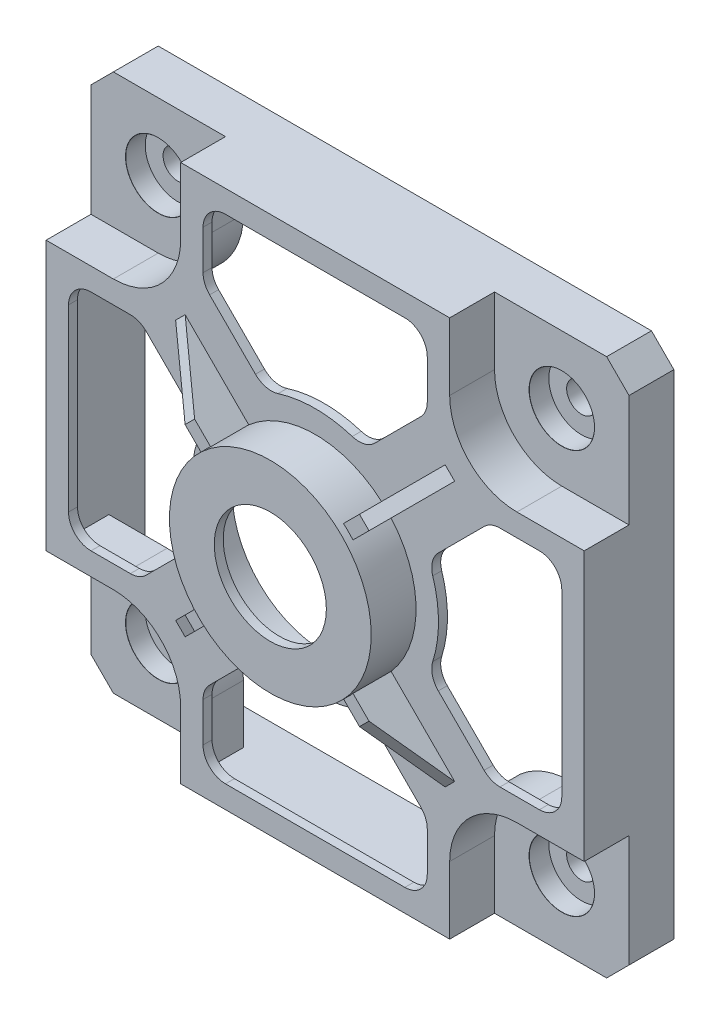
from build123d import *

# Parameters (mm, degrees)
SKETCH1_W                              = 120
SKETCH1_H                              = 120
BOSS_EXTRUDE1_DEPTH                    = 20
SKETCH2_R                              = 22.5
BOSS_EXTRUDE2_DEPTH                    = 10
CUT_EXTRUDE1_DEPTH                     = 10
MIRROR2_COPY_1_DEPTH                   = 10
CHAMFER1_SIZE                          = 5
SHELL1_DEPTH                           = 18
SHELL1_2_DEPTH                         = 8
SHELL1_START                           = 18
SHELL1_3_OUTLINE_R                     = 20.5
SHELL1_3_DEPTH                         = 10
SHELL1_START_2                         = 28
SHELL1_4_OUTLINE_R                     = 12.5
SHELL1_4_DEPTH                         = 2
BOSS_EXTRUDE3_REACH                    = 92
SKETCH6_R                              = 8.75
CIRPATTERN1_COUNT                      = 4
CBORE_FOR_M6_HEX_HEAD_BOLT1_AT_2_COUNT = 2
CBORE_FOR_M6_HEX_HEAD_BOLT1_AT_2_PITCH = 90
CBORE_FOR_M6_HEX_HEAD_BOLT1_AT_3_COUNT = 2
CBORE_FOR_M6_HEX_HEAD_BOLT1_AT_3_PITCH = 127.279220614
CBORE_FOR_M6_HEX_HEAD_BOLT1_AT_4_COUNT = 2
CBORE_FOR_M6_HEX_HEAD_BOLT1_AT_4_PITCH = 90
CUT_EXTRUDE2_REACH                     = 89.178
CIRPATTERN2_COUNT                      = 4
RIB1_START                             = -1.5
RIB1_DEPTH                             = 3
CIRPATTERN3_COUNT                      = 4


# Read off the part's stored shape, not the designer's step: Shell1, Rib1
with BuildPart() as part:
    # Sketch1 → Boss-Extrude1 (new body)
    with BuildSketch(Plane.XY):
        Rectangle(SKETCH1_W, SKETCH1_H)
    extrude(amount=BOSS_EXTRUDE1_DEPTH)

    # Sketch2 → Boss-Extrude2 (add)
    with BuildSketch(Plane.XY.offset(20)):
        Circle(SKETCH2_R)
    extrude(amount=BOSS_EXTRUDE2_DEPTH)

    # Sketch4 → Cut-Extrude1 (cut)
    with BuildSketch(Plane.XY.offset(20)):
        with BuildLine():
            Line((60, 60), (30, 60))
            Line((30, 60), (30, 45))
            ThreePointArc((30, 45), (34.393398282, 34.393398282), (45, 30))
            Line((45, 30), (60, 30))
            Line((60, 30), (60, 60))
        make_face()
    cut_extrude1 = extrude(amount=-CUT_EXTRUDE1_DEPTH, mode=Mode.SUBTRACT)

    # Mirror1: Cut-Extrude1 across plane
    add(cut_extrude1.mirror(Plane(origin=(0, 0, 0), x_dir=(0, 0, 1), z_dir=(1, 0, 0))), mode=Mode.SUBTRACT)

    # Mirror2: Cut-Extrude1 across plane
    add(cut_extrude1.mirror(Plane.ZX), mode=Mode.SUBTRACT)

    # Mirror2 copy 1 sketch → Mirror2 copy 1 (cut)
    with BuildSketch(Plane(origin=(0, 0, 20), x_dir=(-1, 0, 0), z_dir=(0, 0, 1))):
        with BuildLine():
            Line((60, 60), (30, 60))
            Line((30, 60), (30, 45))
            ThreePointArc((30, 45), (34.393398282, 34.393398282), (45, 30))
            Line((45, 30), (60, 30))
            Line((60, 30), (60, 60))
        make_face()
    extrude(amount=-MIRROR2_COPY_1_DEPTH, mode=Mode.SUBTRACT)

    # Chamfer1
    chamfer1_edges = [part.edges().sort_by_distance(p)[0] for p in [
        (60, 60, 5),
        (-60, 60, 5),
        (-60, -60, 5),
        (60, -60, 5),
    ]]
    chamfer(chamfer1_edges, length=CHAMFER1_SIZE)

    # Shell1 outline → Shell1 (cut)
    with BuildSketch(Plane.XY):
        with BuildLine():
            Line((58, -28), (58, 28))
            Line((58, 28), (45, 28))
            ThreePointArc((45, 28), (32.97918472, 32.97918472), (28, 45))
            Line((28, 45), (28, 58))
            Line((28, 58), (-28, 58))
            Line((-28, 58), (-28, 45))
            ThreePointArc((-28, 45), (-32.97918472, 32.97918472), (-45, 28))
            Line((-45, 28), (-58, 28))
            Line((-58, 28), (-58, -28))
            Line((-58, -28), (-45, -28))
            ThreePointArc((-45, -28), (-32.97918472, -32.97918472), (-28, -45))
            Line((-28, -45), (-28, -58))
            Line((-28, -58), (28, -58))
            Line((28, -58), (28, -45))
            ThreePointArc((28, -45), (32.97918472, -32.97918472), (45, -28))
            Line((45, -28), (58, -28))
        make_face()
    extrude(amount=SHELL1_DEPTH, mode=Mode.SUBTRACT)

    # Shell1 2 outline → Shell1 2 (cut)
    with BuildSketch(Plane.XY):
        with BuildLine():
            Line((58, 28), (58, 54.171572875))
            Line((58, 54.171572875), (54.171572875, 58))
            Line((54.171572875, 58), (28, 58))
            Line((28, 58), (28, 45))
            ThreePointArc((28, 45), (32.97918472, 32.97918472), (45, 28))
            Line((45, 28), (58, 28))
        make_face()
        with BuildLine():
            Line((58, -54.171572875), (58, -28))
            Line((58, -28), (45, -28))
            ThreePointArc((45, -28), (32.97918472, -32.97918472), (28, -45))
            Line((28, -45), (28, -58))
            Line((28, -58), (54.171572875, -58))
            Line((54.171572875, -58), (58, -54.171572875))
        make_face()
        with BuildLine():
            Line((-28, 45), (-28, 58))
            Line((-28, 58), (-54.171572875, 58))
            Line((-54.171572875, 58), (-58, 54.171572875))
            Line((-58, 54.171572875), (-58, 28))
            Line((-58, 28), (-45, 28))
            ThreePointArc((-45, 28), (-32.97918472, 32.97918472), (-28, 45))
        make_face()
        with BuildLine():
            Line((-54.171572875, -58), (-28, -58))
            Line((-28, -58), (-28, -45))
            ThreePointArc((-28, -45), (-32.97918472, -32.97918472), (-45, -28))
            Line((-45, -28), (-58, -28))
            Line((-58, -28), (-58, -54.171572875))
            Line((-58, -54.171572875), (-54.171572875, -58))
        make_face()
    extrude(amount=SHELL1_2_DEPTH, mode=Mode.SUBTRACT)

    # Shell1 3 outline → Shell1 3 (cut)
    with BuildSketch(Plane.XY.offset(SHELL1_START)):
        Circle(SHELL1_3_OUTLINE_R)
    extrude(amount=SHELL1_3_DEPTH, mode=Mode.SUBTRACT)

    # Shell1 4 outline → Shell1 4 (cut)
    with BuildSketch(Plane.XY.offset(SHELL1_START_2)):
        Circle(SHELL1_4_OUTLINE_R)
    extrude(amount=SHELL1_4_DEPTH, mode=Mode.SUBTRACT)

    # Sketch6 → Boss-Extrude3 (add, up to next)
    with BuildSketch(Plane(origin=(0, 0, 0), x_dir=(-1, 0, 0), z_dir=(0, 0, -1)), mode=Mode.PRIVATE) as boss_extrude3_sk1:
        with Locations((45, 45)):
            Circle(SKETCH6_R)
    boss_extrude3_tool1 = extrude(boss_extrude3_sk1.sketch, amount=-BOSS_EXTRUDE3_REACH, mode=Mode.PRIVATE) - part.part
    boss_extrude3 = boss_extrude3_tool1.solids().sort_by_distance((-45, 45, 0))[0]
    add(boss_extrude3)

    # CirPattern1: Boss-Extrude3 ×4 about axis
    cirpattern1_axis = Axis((0, 0, 0), (0, 0, 1))
    for i in range(1, CIRPATTERN1_COUNT):
        add(boss_extrude3.rotate(cirpattern1_axis, i * 360 / CIRPATTERN1_COUNT))

    # Sketch8 → CBORE for M6 Hex Head Bolt1 (revolve, cut)
    with BuildSketch(Plane(origin=(45, -45, 10), x_dir=(0, -1, 0), z_dir=(1, 0, 0))):
        Polygon((0, 0), (0, 10), (3.3, 10), (3.3, 4.38), (7.275, 4.38), (7.275, 0.025), (7.3, 0), align=None)
    cbore_for_m6_hex_head_bolt1 = revolve(axis=Axis((45, -45, 16.35), (0, 0, -1)), mode=Mode.SUBTRACT)

    # CBORE for M6 Hex Head Bolt1 at 2: CBORE for M6 Hex Head Bolt1 ×2
    with Locations(*[(-i * CBORE_FOR_M6_HEX_HEAD_BOLT1_AT_2_PITCH, 0, 0) for i in range(1, CBORE_FOR_M6_HEX_HEAD_BOLT1_AT_2_COUNT)]):
        add(cbore_for_m6_hex_head_bolt1, mode=Mode.SUBTRACT)

    # CBORE for M6 Hex Head Bolt1 at 3: CBORE for M6 Hex Head Bolt1 ×2
    with Locations(*[Vector(-0.7071067811865477, 0.7071067811865474, 0) * (i * CBORE_FOR_M6_HEX_HEAD_BOLT1_AT_3_PITCH) for i in range(1, CBORE_FOR_M6_HEX_HEAD_BOLT1_AT_3_COUNT)]):
        add(cbore_for_m6_hex_head_bolt1, mode=Mode.SUBTRACT)

    # CBORE for M6 Hex Head Bolt1 at 4: CBORE for M6 Hex Head Bolt1 ×2
    with Locations(*[(0, i * CBORE_FOR_M6_HEX_HEAD_BOLT1_AT_4_PITCH, 0) for i in range(1, CBORE_FOR_M6_HEX_HEAD_BOLT1_AT_4_COUNT)]):
        add(cbore_for_m6_hex_head_bolt1, mode=Mode.SUBTRACT)

    # Sketch9 → Cut-Extrude2 (cut, up to next)
    with BuildSketch(Plane.XY.offset(20), mode=Mode.PRIVATE) as cut_extrude2_sk1:
        with BuildLine():
            Line((-27.45795085, 13.315815226), (-37.67766953, 23.535533906))
            ThreePointArc((-37.67766953, 23.535533906), (-39.299786274, 24.619397663), (-41.213203436, 25))
            Line((-41.213203436, 25), (-50, 25))
            ThreePointArc((-50, 25), (-53.535533906, 23.535533906), (-55, 20))
            Line((-55, 20), (-55, -20))
            ThreePointArc((-55, -20), (-53.535533906, -23.535533906), (-50, -25))
            Line((-50, -25), (-41.213203436, -25))
            ThreePointArc((-41.213203436, -25), (-39.299786274, -24.619397663), (-37.67766953, -23.535533906))
            Line((-37.67766953, -23.535533906), (-27.45795085, -13.315815226))
            ThreePointArc((-27.45795085, -13.315815226), (-26.136633667, -10.96813548), (-26.225256332, -8.275622655))
            ThreePointArc((-26.225256332, -8.275622655), (-27.5, 0), (-26.225256332, 8.275622655))
            ThreePointArc((-26.225256332, 8.275622655), (-26.136633667, 10.96813548), (-27.45795085, 13.315815226))
        make_face()
    cut_extrude2_tool1 = extrude(cut_extrude2_sk1.sketch, amount=-CUT_EXTRUDE2_REACH, mode=Mode.PRIVATE) & part.part
    cut_extrude2 = cut_extrude2_tool1.solids().sort_by_distance((-42.001629, 0, 20))[0]
    add(cut_extrude2, mode=Mode.SUBTRACT)

    # CirPattern2: Cut-Extrude2 ×4 about axis
    cirpattern2_axis = Axis((0, 0, 0), (0, 0, 1))
    for i in range(1, CIRPATTERN2_COUNT):
        add(cut_extrude2.rotate(cirpattern2_axis, i * 360 / CIRPATTERN2_COUNT), mode=Mode.SUBTRACT)

    # Rib1 outline → Rib1 (add)
    with BuildSketch(Plane(origin=(0, 0, 0), x_dir=(0.7071067811865477, -0.7071067811865475, 0), z_dir=(0.7071067811865475, 0.7071067811865477, 0)).offset(RIB1_START)):
        Polygon((21, -28.5), (27.5, -28.5), (42.5, -20), (21, -20), align=None)
    rib1 = extrude(amount=RIB1_DEPTH)

    # CirPattern3: Rib1 ×4 about axis
    cirpattern3_axis = Axis((0, 0, 0), (0, 0, 1))
    for i in range(1, CIRPATTERN3_COUNT):
        add(rib1.rotate(cirpattern3_axis, i * 360 / CIRPATTERN3_COUNT))


solid = part.part
